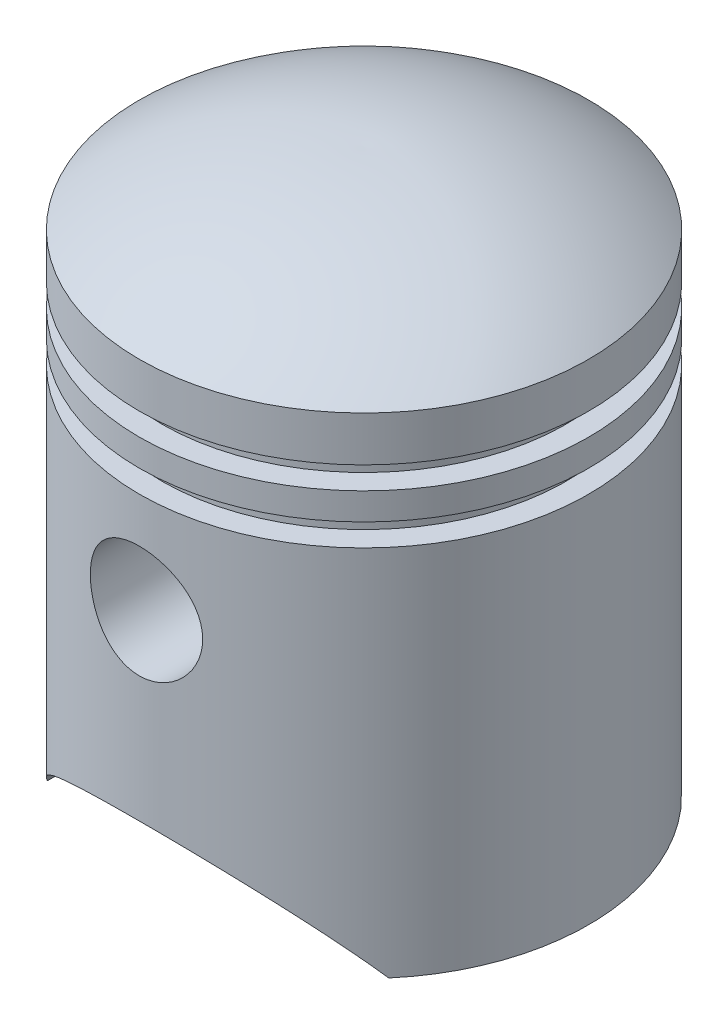
from build123d import *

# Parameters (mm, degrees)
CUT_EXTRUDE2_DEPTH       = 72.817566835
CUT_EXTRUDE2_DEPTH_BACK  = 72.817566835
SKETCH2_R                = 6.25
BOSS_EXTRUDE2_REACH      = 85.818
BOSS_EXTRUDE2_END_RADIUS = 25
BOSS_EXTRUDE2_START      = 12
SKETCH3_R                = 7.25
SKETCH4_R                = 5.75
CUT_EXTRUDE4_DEPTH       = 12
CUT_EXTRUDE5_DEPTH       = 84.269219468
CUT_EXTRUDE5_DEPTH_BACK  = 84.269219468
SKETCH6_R                = 6.25


with BuildPart() as part:
    # Sketch1 → Revolve1 (revolve)
    with BuildSketch(Plane.XY):
        with BuildLine():
            Line((25, 0), (25, 41.5))
            Line((25, 41.5), (22.5, 41.5))
            Line((22.5, 41.5), (22.5, 44))
            Line((22.5, 44), (25, 44))
            Line((25, 44), (25, 47))
            Line((25, 47), (22.5, 47))
            Line((22.5, 47), (22.5, 49.5))
            Line((22.5, 49.5), (25, 49.5))
            Line((25, 49.5), (25, 54.5))
            ThreePointArc((25, 54.5), (13.174901691, 60.609067785), (0, 62.5))
            Line((0, 62.5), (0, 60.49936285))
            ThreePointArc((0, 60.49936285), (12.069492637, 58.859165445), (23, 53.484511145))
            Line((23, 53.484511145), (23, 51.5))
            Line((23, 51.5), (20.5, 51.5))
            Line((20.5, 51.5), (20.5, 45.5))
            Line((20.5, 45.5), (20.5, 39.5))
            Line((20.5, 39.5), (23, 39.5))
            Line((23, 39.5), (23, 0))
            Line((23, 0), (25, 0))
        make_face()
    revolve(axis=Axis((0, 62.5, 0), (0, -1, 0)))

    # Sketch2 → Cut-Extrude2 (cut, two sides: drawn at the far end of the back side and taken through both)
    with BuildSketch(Plane.XY.offset(-CUT_EXTRUDE2_DEPTH_BACK)):
        with Locations((0, 30.5)):
            Circle(SKETCH2_R)
        with BuildLine():
            Line((-19, 0), (19, 0))
            ThreePointArc((19, 0), (0, 10), (-19, 0))
        make_face()
    extrude(amount=CUT_EXTRUDE2_DEPTH + CUT_EXTRUDE2_DEPTH_BACK, mode=Mode.SUBTRACT)

    # Boss-Extrude2: up to this cylinder (the profile starts inside it)
    boss_extrude2_end = Plane(origin=(0, 30.5, 0), z_dir=(0, 1, 0)) * Cylinder(BOSS_EXTRUDE2_END_RADIUS, 222.636, mode=Mode.PRIVATE)
    # Sketch3 → Boss-Extrude2 (add, up to the surface)
    with BuildSketch(Plane.XY.offset(BOSS_EXTRUDE2_START), mode=Mode.PRIVATE) as boss_extrude2_sk1:
        with Locations((0, 30.5)):
            Circle(SKETCH3_R)
    boss_extrude2_tool1 = extrude(boss_extrude2_sk1.sketch, amount=BOSS_EXTRUDE2_REACH, mode=Mode.PRIVATE) & boss_extrude2_end
    boss_extrude2 = boss_extrude2_tool1.solids().sort_by_distance((0, 30.5, 12))[0]
    add(boss_extrude2)

    # Sketch4 → Cut-Extrude4 (cut)
    with BuildSketch(Plane(origin=(0, 0, 12), x_dir=(-1, 0, 0), z_dir=(0, 0, -1))):
        with Locations((0, 30.5)):
            Circle(SKETCH4_R)
    cut_extrude4 = extrude(amount=-CUT_EXTRUDE4_DEPTH, mode=Mode.SUBTRACT)

    # Mirror1: Boss-Extrude2, Cut-Extrude4 across plane
    add(boss_extrude2.mirror(Plane.XY))
    add(cut_extrude4.mirror(Plane.XY), mode=Mode.SUBTRACT)

    # Sketch6 → Cut-Extrude5 (cut, two sides: drawn at the far end of the back side and taken through both)
    with BuildSketch(Plane.XY.offset(-24).offset(-CUT_EXTRUDE5_DEPTH_BACK)):
        with Locations((0, 30.244303223)):
            Circle(SKETCH6_R)
    extrude(amount=CUT_EXTRUDE5_DEPTH + CUT_EXTRUDE5_DEPTH_BACK, mode=Mode.SUBTRACT)


solid = part.part
